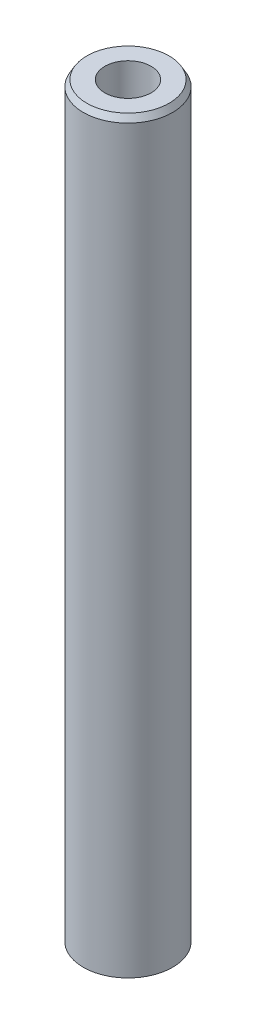
from build123d import *
from OCP.BRepFilletAPI import BRepFilletAPI_MakeChamfer

# Parameters (mm, degrees)
SKETCH1_R           = 10
BOSS_EXTRUDE1_DEPTH = 167.920377102
SKETCH2_R           = 5.171269945
CUT_EXTRUDE1_DEPTH  = 169.51484518
CHAMFER1_SIZE       = 1.381155823
CHAMFER1_SIZE2      = 0.797410686


with BuildPart() as part:
    # Sketch1 → Boss-Extrude1 (new body)
    with BuildSketch(Plane(origin=(0, 0, 0), x_dir=(1, 0, 0), z_dir=(0, 1, 0))):
        Circle(SKETCH1_R)
    extrude(amount=BOSS_EXTRUDE1_DEPTH)

    # Sketch2 → Cut-Extrude1 (cut, through all)
    with BuildSketch(Plane(origin=(0, 0, 0), x_dir=(1, 0, 0), z_dir=(0, 1, 0))):
        Circle(SKETCH2_R)
    extrude(amount=CUT_EXTRUDE1_DEPTH, mode=Mode.SUBTRACT)

    # Chamfer1: one chamfer whose edges measure the first distance from different faces: ONE call of the kernel's chamfer builder (chamfer() names one face for all edges)
    chamfer1_edges_1 = [part.edges().sort_by_distance(p)[0] for p in [
        (-10, 167.920377102, 0),
    ]]
    chamfer1_side_1 = [part.faces().sort_by_distance(p)[0] for p in [
        (-10, 83.960188551, 0),
    ]]
    chamfer1_edges_2 = [part.edges().sort_by_distance(p)[0] for p in [
        (-10, 0, 0),
    ]]
    chamfer1_side_2 = [part.faces().sort_by_distance(p)[0] for p in [
        (-9.717157288, 0, 0),
    ]]
    chamfer1 = BRepFilletAPI_MakeChamfer(part.part.solid().wrapped)
    for e in chamfer1_edges_1:
        chamfer1.Add(CHAMFER1_SIZE, CHAMFER1_SIZE2, e.wrapped, chamfer1_side_1[0].wrapped)  # the first distance lies on this face
    for e in chamfer1_edges_2:
        chamfer1.Add(CHAMFER1_SIZE, CHAMFER1_SIZE2, e.wrapped, chamfer1_side_2[0].wrapped)  # the first distance lies on this face
    add(Compound.cast(chamfer1.Shape()), mode=Mode.REPLACE)


solid = part.part
